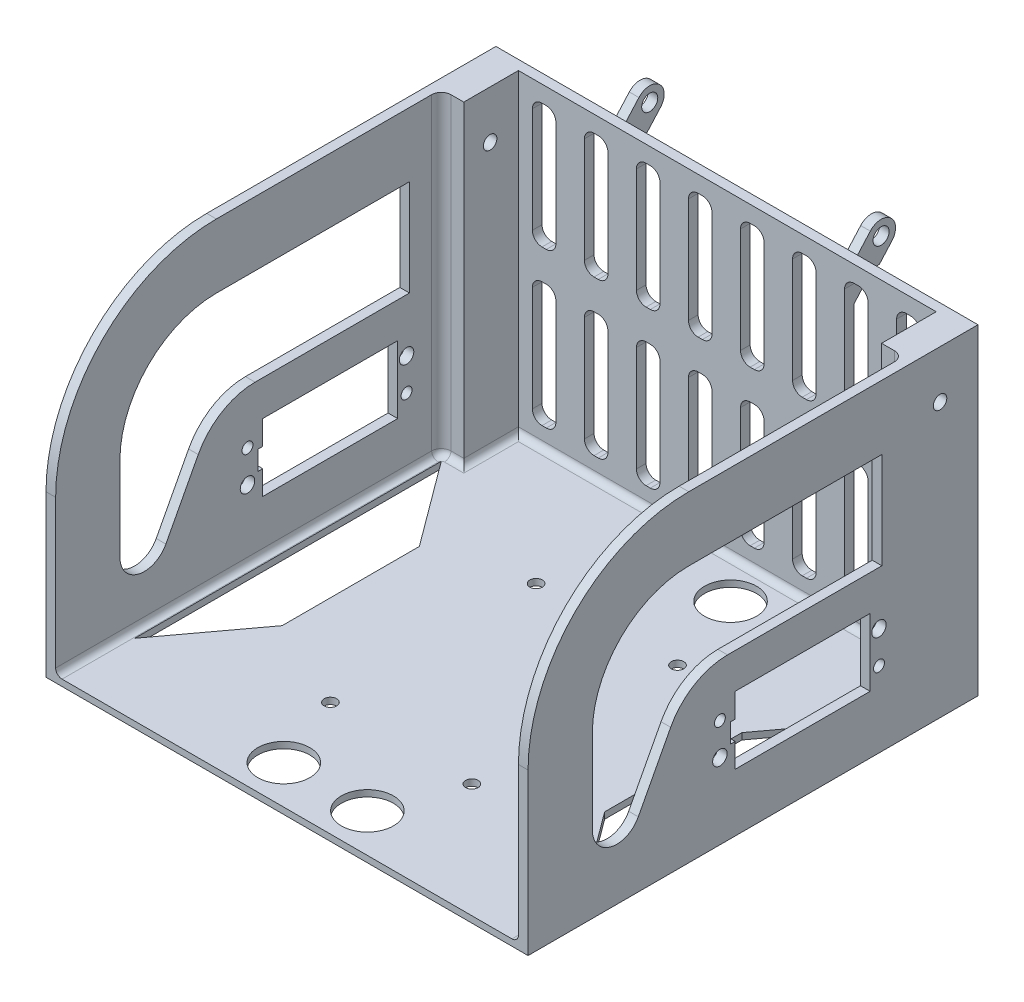
from build123d import *

# Parameters (mm, degrees)
BOSS_EXTRUDE1_DEPTH              = 150
SKETCH2_W                        = 144
SKETCH2_H                        = 142
CUT_EXTRUDE1_DEPTH               = 98
SKETCH1_4_W                      = 20
SKETCH1_4_H                      = 100
SALIENTE_EXTRUIR1_DEPTH          = 10
SKETCH3_R                        = 2.5
BOSS_EXTRUDE2_DEPTH              = 1.5
REDONDEO3_R                      = 3
SKETCH4_R                        = 2.1
SKETCH4_W                        = 42
SKETCH4_H                        = 21
CUT_EXTRUDE2_DEPTH               = 231.936733782
CORTAR_EXTRUIR8_REACH            = 231.13
CROQUIS13_W                      = 7.320857372
CROQUIS13_H                      = 38.747854906
REDONDEO6_R                      = 3
MATRIZL1_COUNT                   = 8
MATRIZL1_PITCH                   = 16.191367331
REDONDEO6_OF_MATRIZL1_R          = 3
MATRIZL2_DEPTH                   = 3
TALADRO_DE_MARGEN_PARA_M31_D     = 3.4
TALADRO_DE_MARGEN_PARA_M31_DEPTH = 3
TALADRO_DE_MARGEN_PARA_M41_D     = 4.5
TALADRO_DE_MARGEN_PARA_M41_DEPTH = 3
CORTAR_EXTRUIR1_REACH            = 231
REDONDEO1_R                      = 20
CORTAR_EXTRUIR2_REACH            = 232.937
SKETCH4_4_W                      = 1.4
SKETCH4_4_H                      = 6
REDONDEO4_R                      = 3
REDONDEO1_OF_SIMETR_A2_R         = 20
REDONDEO5_R                      = 2
CORTAR_EXTRUIR3_REACH            = 232.026
CROQUIS8_R                       = 8.1
CORTAR_EXTRUIR5_REACH            = 232.026
CROQUIS11_R                      = 1.95
CORTAR_EXTRUIR6_REACH            = 232.026


# Read off the part's stored shape, not the designer's step: MatrizL2
with BuildPart() as part:
    # Sketch1 → Boss-Extrude1 (new body)
    with BuildSketch(Plane(origin=(0, 0, 0), x_dir=(0, 0, -1), z_dir=(1, 0, 0))):
        with BuildLine():
            Line((0, 0), (-140, 0))
            Line((-140, 0), (-140, 50))
            ThreePointArc((-140, 50), (-125.355339059, 85.355339059), (-90, 100))
            Line((-90, 100), (0, 100))
            Line((0, 100), (0, 0))
        make_face()
    extrude(amount=BOSS_EXTRUDE1_DEPTH)

    # Sketch2 → Cut-Extrude1 (cut)
    with BuildSketch(Plane(origin=(0, 100, 0), x_dir=(1, 0, 0), z_dir=(0, 1, 0))):
        with Locations((75, -74)):
            Rectangle(SKETCH2_W, SKETCH2_H)
    extrude(amount=-CUT_EXTRUDE1_DEPTH, mode=Mode.SUBTRACT)

    # Sketch1<4> → Saliente-Extruir1 (add)
    with BuildSketch(Plane(origin=(0, 0, 0), x_dir=(0, 0, -1), z_dir=(1, 0, 0))):
        with Locations((-10, 50)):
            Rectangle(SKETCH1_4_W, SKETCH1_4_H)
    saliente_extruir1 = extrude(amount=SALIENTE_EXTRUIR1_DEPTH)

    # Sketch3 → Boss-Extrude2 (add, symmetric)
    with BuildSketch(Plane(origin=(111, 0, 0), x_dir=(0, 0, -1), z_dir=(1, 0, 0))):
        with BuildLine():
            Line((0, 100), (0, 86.483689179))
            Line((0, 86.483689179), (10.709846007, 98.483689179))
            ThreePointArc((10.709846007, 98.483689179), (10.348889249, 104.837405432), (3.995172996, 104.476448674))
            Line((3.995172996, 104.476448674), (0, 100))
        make_face()
        with Locations((7.352509502, 101.480068927)):
            Circle(SKETCH3_R, mode=Mode.SUBTRACT)
    boss_extrude2 = extrude(amount=BOSS_EXTRUDE2_DEPTH, both=True)

    # Mirror1: Boss-Extrude2 across plane
    add(boss_extrude2.mirror(Plane(origin=(75, 0, 0), x_dir=(0, 0, 1), z_dir=(1, 0, 0))))

    # Redondeo3
    redondeo3_edges = [part.edges().sort_by_distance(p)[0] for p in [
        (3, 51, 20),
    ]]
    fillet(redondeo3_edges, radius=REDONDEO3_R)

    # Simetría1: Saliente-Extruir1 across plane
    add(saliente_extruir1.mirror(Plane(origin=(75, 0, 0), x_dir=(0, 0, 1), z_dir=(1, 0, 0))))

    # Sketch4 → Cut-Extrude2 (cut, through all)
    with BuildSketch(Plane(origin=(150, 0, 0), x_dir=(0, 0, -1), z_dir=(1, 0, 0))):
        with Locations((-11.810728321, 85.063406284)):
            Circle(SKETCH4_R)
        with Locations((-54.561214212, 28.49486379)):
            Rectangle(SKETCH4_W, SKETCH4_H)
    extrude(amount=-CUT_EXTRUDE2_DEPTH, mode=Mode.SUBTRACT)

    # Croquis13 → Cortar-Extruir8 (cut, up to next)
    with BuildSketch(Plane.XY.offset(3), mode=Mode.PRIVATE) as cortar_extruir8_sk1:
        with Locations((18, 75.5)):
            Rectangle(CROQUIS13_W, CROQUIS13_H)
    cortar_extruir8_tool1 = extrude(cortar_extruir8_sk1.sketch, amount=-CORTAR_EXTRUIR8_REACH, mode=Mode.PRIVATE) & part.part
    cortar_extruir8 = cortar_extruir8_tool1.solids().sort_by_distance((18, 75.5, 3))[0]
    add(cortar_extruir8, mode=Mode.SUBTRACT)

    # Redondeo6
    redondeo6_edges = [part.edges().sort_by_distance(p)[0] for p in [
        (14.339571314, 56.126072547, 1.5),
        (14.339571314, 94.873927453, 1.5),
        (21.660428686, 94.873927453, 1.5),
        (21.660428686, 56.126072547, 1.5),
    ]]
    fillet(redondeo6_edges, radius=REDONDEO6_R)

    # MatrizL1: Cortar-Extruir8; each copy of Cortar-Extruir8 runs up to whatever stops it at its own place
    matrizl1_before = part.part  # the part as the pattern finds it: every copy runs up to it
    matrizl1_cortar_extruir8_long = extrude(cortar_extruir8_sk1.sketch, amount=-CORTAR_EXTRUIR8_REACH, mode=Mode.PRIVATE)
    matrizl1_cortar_extruir8_tool1 = matrizl1_cortar_extruir8_long.moved(Location(Vector(1, 0, 0) * (1 * MATRIZL1_PITCH))) & matrizl1_before
    add(matrizl1_cortar_extruir8_tool1.solids().sort_by_distance((34.191367, 75.5, 3))[0], mode=Mode.SUBTRACT)
    matrizl1_cortar_extruir8_tool2 = matrizl1_cortar_extruir8_long.moved(Location(Vector(1, 0, 0) * (2 * MATRIZL1_PITCH))) & matrizl1_before
    add(matrizl1_cortar_extruir8_tool2.solids().sort_by_distance((50.382735, 75.5, 3))[0], mode=Mode.SUBTRACT)
    matrizl1_cortar_extruir8_tool3 = matrizl1_cortar_extruir8_long.moved(Location(Vector(1, 0, 0) * (3 * MATRIZL1_PITCH))) & matrizl1_before
    add(matrizl1_cortar_extruir8_tool3.solids().sort_by_distance((66.574102, 75.5, 3))[0], mode=Mode.SUBTRACT)
    matrizl1_cortar_extruir8_tool4 = matrizl1_cortar_extruir8_long.moved(Location(Vector(1, 0, 0) * (4 * MATRIZL1_PITCH))) & matrizl1_before
    add(matrizl1_cortar_extruir8_tool4.solids().sort_by_distance((82.765469, 75.5, 3))[0], mode=Mode.SUBTRACT)
    matrizl1_cortar_extruir8_tool5 = matrizl1_cortar_extruir8_long.moved(Location(Vector(1, 0, 0) * (5 * MATRIZL1_PITCH))) & matrizl1_before
    add(matrizl1_cortar_extruir8_tool5.solids().sort_by_distance((98.956837, 75.5, 3))[0], mode=Mode.SUBTRACT)
    matrizl1_cortar_extruir8_tool6 = matrizl1_cortar_extruir8_long.moved(Location(Vector(1, 0, 0) * (6 * MATRIZL1_PITCH))) & matrizl1_before
    add(matrizl1_cortar_extruir8_tool6.solids().sort_by_distance((115.148204, 75.5, 3))[0], mode=Mode.SUBTRACT)
    matrizl1_cortar_extruir8_tool7 = matrizl1_cortar_extruir8_long.moved(Location(Vector(1, 0, 0) * (7 * MATRIZL1_PITCH))) & matrizl1_before
    add(matrizl1_cortar_extruir8_tool7.solids().sort_by_distance((131.339571, 75.5, 3))[0], mode=Mode.SUBTRACT)

    # Redondeo6 of MatrizL1
    redondeo6_of_matrizl1_edges = [part.edges().sort_by_distance(p)[0] for p in [
        (30.530938645, 56.126072547, 1.5),
        (30.530938645, 94.873927453, 1.5),
        (37.851796016, 94.873927453, 1.5),
        (37.851796016, 56.126072547, 1.5),
        (46.722305976, 56.126072547, 1.5),
        (46.722305976, 94.873927453, 1.5),
        (54.043163347, 94.873927453, 1.5),
        (54.043163347, 56.126072547, 1.5),
        (62.913673306, 56.126072547, 1.5),
        (62.913673306, 94.873927453, 1.5),
        (70.234530678, 94.873927453, 1.5),
        (70.234530678, 56.126072547, 1.5),
        (79.105040637, 56.126072547, 1.5),
        (79.105040637, 94.873927453, 1.5),
        (86.425898008, 94.873927453, 1.5),
        (86.425898008, 56.126072547, 1.5),
        (95.296407967, 56.126072547, 1.5),
        (95.296407967, 94.873927453, 1.5),
        (102.617265339, 94.873927453, 1.5),
        (102.617265339, 56.126072547, 1.5),
        (111.487775298, 56.126072547, 1.5),
        (111.487775298, 94.873927453, 1.5),
        (118.808632669, 94.873927453, 1.5),
        (118.808632669, 56.126072547, 1.5),
        (127.679142629, 56.126072547, 1.5),
        (127.679142629, 94.873927453, 1.5),
        (135, 94.873927453, 1.5),
        (135, 56.126072547, 1.5),
    ]]
    fillet(redondeo6_of_matrizl1_edges, radius=REDONDEO6_OF_MATRIZL1_R)

    # MatrizL2 outline → MatrizL2 (cut)
    with BuildSketch(Plane.XY):
        with BuildLine():
            Line((14.339571314, 43.747854905), (14.339571314, 11))
            ThreePointArc((14.339571314, 11), (15.21825097, 8.878679656), (17.339571314, 8))
            Line((17.339571314, 8), (18.660428686, 8))
            ThreePointArc((18.660428686, 8), (20.781749029, 8.878679656), (21.660428686, 11))
            Line((21.660428686, 11), (21.660428686, 43.747854905))
            ThreePointArc((21.660428686, 43.747854905), (20.78174903, 45.869175248), (18.660428686, 46.747854905))
            Line((18.660428686, 46.747854905), (17.339571314, 46.747854905))
            ThreePointArc((17.339571314, 46.747854905), (15.21825097, 45.869175248), (14.339571314, 43.747854905))
        make_face()
        with BuildLine():
            Line((30.530938645, 43.747854905), (30.530938645, 11))
            ThreePointArc((30.530938645, 11), (31.409618301, 8.878679656), (33.530938645, 8))
            Line((33.530938645, 8), (34.851796016, 8))
            ThreePointArc((34.851796016, 8), (36.97311636, 8.878679656), (37.851796016, 11))
            Line((37.851796016, 11), (37.851796016, 43.747854905))
            ThreePointArc((37.851796016, 43.747854905), (36.97311636, 45.869175249), (34.851796016, 46.747854905))
            Line((34.851796016, 46.747854905), (33.530938645, 46.747854905))
            ThreePointArc((33.530938645, 46.747854905), (31.409618301, 45.869175249), (30.530938645, 43.747854905))
        make_face()
        with BuildLine():
            Line((111.487775298, 43.747854905), (111.487775298, 11))
            ThreePointArc((111.487775298, 11), (112.366454954, 8.878679656), (114.487775298, 8))
            Line((114.487775298, 8), (115.808632669, 8))
            ThreePointArc((115.808632669, 8), (117.929953013, 8.878679656), (118.808632669, 11))
            Line((118.808632669, 11), (118.808632669, 43.747854905))
            ThreePointArc((118.808632669, 43.747854905), (117.929953013, 45.869175249), (115.808632669, 46.747854905))
            Line((115.808632669, 46.747854905), (114.487775298, 46.747854905))
            ThreePointArc((114.487775298, 46.747854905), (112.366454954, 45.869175249), (111.487775298, 43.747854905))
        make_face()
        with BuildLine():
            Line((127.679142629, 43.747854905), (127.679142629, 11))
            ThreePointArc((127.679142629, 11), (128.557822285, 8.878679656), (130.679142629, 8))
            Line((130.679142629, 8), (132, 8))
            ThreePointArc((132, 8), (134.121320344, 8.878679656), (135, 11))
            Line((135, 11), (135, 43.747854905))
            ThreePointArc((135, 43.747854905), (134.121320344, 45.869175249), (132, 46.747854905))
            Line((132, 46.747854905), (130.679142629, 46.747854905))
            ThreePointArc((130.679142629, 46.747854905), (128.557822285, 45.869175249), (127.679142629, 43.747854905))
        make_face()
        with BuildLine():
            Line((95.296407967, 43.747854905), (95.296407967, 11))
            ThreePointArc((95.296407967, 11), (96.175087624, 8.878679657), (98.296407967, 8))
            Line((98.296407967, 8), (99.617265339, 8))
            ThreePointArc((99.617265339, 8), (101.738585682, 8.878679657), (102.617265339, 11))
            Line((102.617265339, 11), (102.617265339, 43.747854905))
            ThreePointArc((102.617265339, 43.747854905), (101.738585683, 45.869175248), (99.617265339, 46.747854905))
            Line((99.617265339, 46.747854905), (98.296407967, 46.747854905))
            ThreePointArc((98.296407967, 46.747854905), (96.175087623, 45.869175248), (95.296407967, 43.747854905))
        make_face()
        with BuildLine():
            Line((79.105040637, 43.747854905), (79.105040637, 11))
            ThreePointArc((79.105040637, 11), (79.983720293, 8.878679656), (82.105040637, 8))
            Line((82.105040637, 8), (83.425898008, 8))
            ThreePointArc((83.425898008, 8), (85.547218352, 8.878679656), (86.425898008, 11))
            Line((86.425898008, 11), (86.425898008, 43.747854905))
            ThreePointArc((86.425898008, 43.747854905), (85.547218352, 45.869175249), (83.425898008, 46.747854905))
            Line((83.425898008, 46.747854905), (82.105040637, 46.747854905))
            ThreePointArc((82.105040637, 46.747854905), (79.983720293, 45.869175249), (79.105040637, 43.747854905))
        make_face()
        with BuildLine():
            Line((62.913673306, 43.747854905), (62.913673306, 11))
            ThreePointArc((62.913673306, 11), (63.792352963, 8.878679656), (65.913673306, 8))
            Line((65.913673306, 8), (67.234530678, 8))
            ThreePointArc((67.234530678, 8), (69.355851022, 8.878679656), (70.234530678, 11))
            Line((70.234530678, 11), (70.234530678, 43.747854905))
            ThreePointArc((70.234530678, 43.747854905), (69.355851022, 45.869175248), (67.234530678, 46.747854905))
            Line((67.234530678, 46.747854905), (65.913673306, 46.747854905))
            ThreePointArc((65.913673306, 46.747854905), (63.792352962, 45.869175248), (62.913673306, 43.747854905))
        make_face()
        with BuildLine():
            Line((46.722305976, 43.747854905), (46.722305976, 11))
            ThreePointArc((46.722305976, 11), (47.600985632, 8.878679656), (49.722305976, 8))
            Line((49.722305976, 8), (51.043163347, 8))
            ThreePointArc((51.043163347, 8), (53.16448369, 8.878679656), (54.043163347, 11))
            Line((54.043163347, 11), (54.043163347, 43.747854905))
            ThreePointArc((54.043163347, 43.747854905), (53.16448369, 45.869175248), (51.043163347, 46.747854905))
            Line((51.043163347, 46.747854905), (49.722305976, 46.747854905))
            ThreePointArc((49.722305976, 46.747854905), (47.600985632, 45.869175249), (46.722305976, 43.747854905))
        make_face()
    extrude(amount=MATRIZL2_DEPTH, mode=Mode.SUBTRACT)

    # Taladro de margen para M31
    with Locations(Plane(origin=(150, 0, 0), x_dir=(0, 0, -1), z_dir=(1, 0, 0))):
        with Locations((-80.311214212, 33.49486379), (-30.811214212, 23.49486379)):
            taladro_de_margen_para_m31 = Hole(TALADRO_DE_MARGEN_PARA_M31_D / 2, depth=TALADRO_DE_MARGEN_PARA_M31_DEPTH)

    # Taladro de margen para M41
    with Locations(Plane(origin=(150, 0, 0), x_dir=(0, 0, -1), z_dir=(1, 0, 0))):
        with Locations((-80.311214212, 23.49486379), (-30.811214212, 33.49486379)):
            taladro_de_margen_para_m41 = Hole(TALADRO_DE_MARGEN_PARA_M41_D / 2, depth=TALADRO_DE_MARGEN_PARA_M41_DEPTH)

    # Croquis5 → Cortar-Extruir1 (cut, up to next)
    with BuildSketch(Plane.ZY.offset(-147), mode=Mode.PRIVATE) as cortar_extruir1_sk1:
        with BuildLine():
            Line((120, 50), (120, 23.786469398))
            ThreePointArc((120, 23.786469398), (114.235115541, 16.419925341), (105.698855292, 20.245121433))
            Line((105.698855292, 20.245121433), (90, 50))
            Line((90, 50), (29.908417384, 50))
            Line((29.908417384, 50), (29.908417384, 80))
            Line((29.908417384, 80), (90, 80))
            ThreePointArc((90, 80), (111.213203436, 71.213203436), (120, 50))
        make_face()
    cortar_extruir1_tool1 = extrude(cortar_extruir1_sk1.sketch, amount=-CORTAR_EXTRUIR1_REACH, mode=Mode.PRIVATE) & part.part
    cortar_extruir1 = cortar_extruir1_tool1.solids().sort_by_distance((147, 58.173, 79.970314))[0]
    add(cortar_extruir1, mode=Mode.SUBTRACT)

    # Redondeo1
    redondeo1_edges = [part.edges().sort_by_distance(p)[0] for p in [
        (148.5, 50, 90),
    ]]
    fillet(redondeo1_edges, radius=REDONDEO1_R)

    # Sketch4<4> → Cortar-Extruir2 (cut, up to next)
    with BuildSketch(Plane(origin=(150, 0, 0), x_dir=(0, 0, -1), z_dir=(1, 0, 0)), mode=Mode.PRIVATE) as cortar_extruir2_sk1:
        with Locations((-76.261214212, 28.49486379)):
            Rectangle(SKETCH4_4_W, SKETCH4_4_H)
    cortar_extruir2_tool1 = extrude(cortar_extruir2_sk1.sketch, amount=-CORTAR_EXTRUIR2_REACH, mode=Mode.PRIVATE) & part.part
    cortar_extruir2 = cortar_extruir2_tool1.solids().sort_by_distance((150, 28.494864, 76.261214))[0]
    add(cortar_extruir2, mode=Mode.SUBTRACT)

    # Redondeo4
    redondeo4_edges = [part.edges().sort_by_distance(p)[0] for p in [
        (147, 51, 20),
    ]]
    fillet(redondeo4_edges, radius=REDONDEO4_R)

    # Simetría2: Taladro de margen para M31, Taladro de margen para M41, Cortar-Extruir1, Cortar-Extruir2 across plane
    add(taladro_de_margen_para_m31.mirror(Plane(origin=(75, 0, 0), x_dir=(0, 0, 1), z_dir=(1, 0, 0))), mode=Mode.SUBTRACT)
    add(taladro_de_margen_para_m41.mirror(Plane(origin=(75, 0, 0), x_dir=(0, 0, 1), z_dir=(1, 0, 0))), mode=Mode.SUBTRACT)
    add(cortar_extruir1.mirror(Plane(origin=(75, 0, 0), x_dir=(0, 0, 1), z_dir=(1, 0, 0))), mode=Mode.SUBTRACT)
    add(cortar_extruir2.mirror(Plane(origin=(75, 0, 0), x_dir=(0, 0, 1), z_dir=(1, 0, 0))), mode=Mode.SUBTRACT)

    # Redondeo1 of Simetría2
    redondeo1_of_simetr_a2_edges = [part.edges().sort_by_distance(p)[0] for p in [
        (1.5, 50, 90),
    ]]
    fillet(redondeo1_of_simetr_a2_edges, radius=REDONDEO1_OF_SIMETR_A2_R)

    # Redondeo5
    redondeo5_edges = [part.edges().sort_by_distance(p)[0] for p in [
        (75, 2, 3),
        (140, 2, 11.5),
        (147, 2, 81.5),
        (10, 2, 11.5),
        (142, 2, 20),
        (146.121320344, 2, 20.878679656),
        (8, 2, 20),
        (3, 2, 81.5),
        (3.878679656, 2, 20.878679656),
    ]]
    fillet(redondeo5_edges, radius=REDONDEO5_R)

    # Croquis8 → Cortar-Extruir3 (cut, up to next)
    with BuildSketch(Plane(origin=(0, 2, 0), x_dir=(1, 0, 0), z_dir=(0, 1, 0)), mode=Mode.PRIVATE) as cortar_extruir3_sk1:
        with Locations(Location((88, -128, 0), (0, 0, 270))):
            Circle(CROQUIS8_R)
    cortar_extruir3_tool1 = extrude(cortar_extruir3_sk1.sketch, amount=-CORTAR_EXTRUIR3_REACH, mode=Mode.PRIVATE) & part.part
    # Croquis8 → Cortar-Extruir3 (cut, up to next)
    with BuildSketch(Plane(origin=(0, 2, 0), x_dir=(1, 0, 0), z_dir=(0, 1, 0)), mode=Mode.PRIVATE) as cortar_extruir3_sk2:
        with Locations(Location((62, -128, 0), (0, 0, 90))):
            Circle(CROQUIS8_R)
    cortar_extruir3_tool2 = extrude(cortar_extruir3_sk2.sketch, amount=-CORTAR_EXTRUIR3_REACH, mode=Mode.PRIVATE) & part.part
    # Croquis8 → Cortar-Extruir3 (cut, up to next)
    with BuildSketch(Plane(origin=(0, 2, 0), x_dir=(1, 0, 0), z_dir=(0, 1, 0)), mode=Mode.PRIVATE) as cortar_extruir3_sk3:
        with Locations(Location((88, -15, 0), (0, 0, 270))):
            Circle(CROQUIS8_R)
    cortar_extruir3_tool3 = extrude(cortar_extruir3_sk3.sketch, amount=-CORTAR_EXTRUIR3_REACH, mode=Mode.PRIVATE) & part.part
    # Croquis8 → Cortar-Extruir3 (cut, up to next)
    with BuildSketch(Plane(origin=(0, 2, 0), x_dir=(1, 0, 0), z_dir=(0, 1, 0)), mode=Mode.PRIVATE) as cortar_extruir3_sk4:
        with Locations(Location((62, -15, 0), (0, 0, 90))):
            Circle(CROQUIS8_R)
    cortar_extruir3_tool4 = extrude(cortar_extruir3_sk4.sketch, amount=-CORTAR_EXTRUIR3_REACH, mode=Mode.PRIVATE) & part.part
    add(cortar_extruir3_tool1.solids().sort_by_distance((88, 2, 128))[0], mode=Mode.SUBTRACT)
    add(cortar_extruir3_tool2.solids().sort_by_distance((62, 2, 128))[0], mode=Mode.SUBTRACT)
    add(cortar_extruir3_tool3.solids().sort_by_distance((88, 2, 15))[0], mode=Mode.SUBTRACT)
    add(cortar_extruir3_tool4.solids().sort_by_distance((62, 2, 15))[0], mode=Mode.SUBTRACT)

    # Croquis11 → Cortar-Extruir5 (cut, up to next)
    with BuildSketch(Plane(origin=(0, 2, 0), x_dir=(1, 0, 0), z_dir=(0, 1, 0)), mode=Mode.PRIVATE) as cortar_extruir5_sk1:
        with Locations(Location((97, -40.5, 0), (0, 0, 270))):
            Circle(CROQUIS11_R)
    cortar_extruir5_tool1 = extrude(cortar_extruir5_sk1.sketch, amount=-CORTAR_EXTRUIR5_REACH, mode=Mode.PRIVATE) & part.part
    # Croquis11 → Cortar-Extruir5 (cut, up to next)
    with BuildSketch(Plane(origin=(0, 2, 0), x_dir=(1, 0, 0), z_dir=(0, 1, 0)), mode=Mode.PRIVATE) as cortar_extruir5_sk2:
        with Locations(Location((53, -40.5, 0), (0, 0, 90))):
            Circle(CROQUIS11_R)
    cortar_extruir5_tool2 = extrude(cortar_extruir5_sk2.sketch, amount=-CORTAR_EXTRUIR5_REACH, mode=Mode.PRIVATE) & part.part
    # Croquis11 → Cortar-Extruir5 (cut, up to next)
    with BuildSketch(Plane(origin=(0, 2, 0), x_dir=(1, 0, 0), z_dir=(0, 1, 0)), mode=Mode.PRIVATE) as cortar_extruir5_sk3:
        with Locations(Location((97, -104.5, 0), (0, 0, 90))):
            Circle(CROQUIS11_R)
    cortar_extruir5_tool3 = extrude(cortar_extruir5_sk3.sketch, amount=-CORTAR_EXTRUIR5_REACH, mode=Mode.PRIVATE) & part.part
    # Croquis11 → Cortar-Extruir5 (cut, up to next)
    with BuildSketch(Plane(origin=(0, 2, 0), x_dir=(1, 0, 0), z_dir=(0, 1, 0)), mode=Mode.PRIVATE) as cortar_extruir5_sk4:
        with Locations(Location((53, -104.5, 0), (0, 0, 270))):
            Circle(CROQUIS11_R)
    cortar_extruir5_tool4 = extrude(cortar_extruir5_sk4.sketch, amount=-CORTAR_EXTRUIR5_REACH, mode=Mode.PRIVATE) & part.part
    add(cortar_extruir5_tool1.solids().sort_by_distance((97, 2, 40.5))[0], mode=Mode.SUBTRACT)
    add(cortar_extruir5_tool2.solids().sort_by_distance((53, 2, 40.5))[0], mode=Mode.SUBTRACT)
    add(cortar_extruir5_tool3.solids().sort_by_distance((97, 2, 104.5))[0], mode=Mode.SUBTRACT)
    add(cortar_extruir5_tool4.solids().sort_by_distance((53, 2, 104.5))[0], mode=Mode.SUBTRACT)

    # Croquis12 → Cortar-Extruir6 (cut, up to next)
    with BuildSketch(Plane(origin=(0, 2, 0), x_dir=(1, 0, 0), z_dir=(0, 1, 0)), mode=Mode.PRIVATE) as cortar_extruir6_sk1:
        Polygon((144.707106781, -22.292893219), (144.707106781, -117.707106781), (125.175643157, -91.351996496), (125.175643157, -48.648003504), align=None)
    cortar_extruir6_tool1 = extrude(cortar_extruir6_sk1.sketch, amount=-CORTAR_EXTRUIR6_REACH, mode=Mode.PRIVATE) & part.part
    cortar_extruir6 = cortar_extruir6_tool1.solids().sort_by_distance((136.183678, 2, 70))[0]
    add(cortar_extruir6, mode=Mode.SUBTRACT)

    # Simetría4: Cortar-Extruir6 across plane
    add(cortar_extruir6.mirror(Plane(origin=(75, 0, 0), x_dir=(0, 0, 1), z_dir=(1, 0, 0))), mode=Mode.SUBTRACT)


solid = part.part
